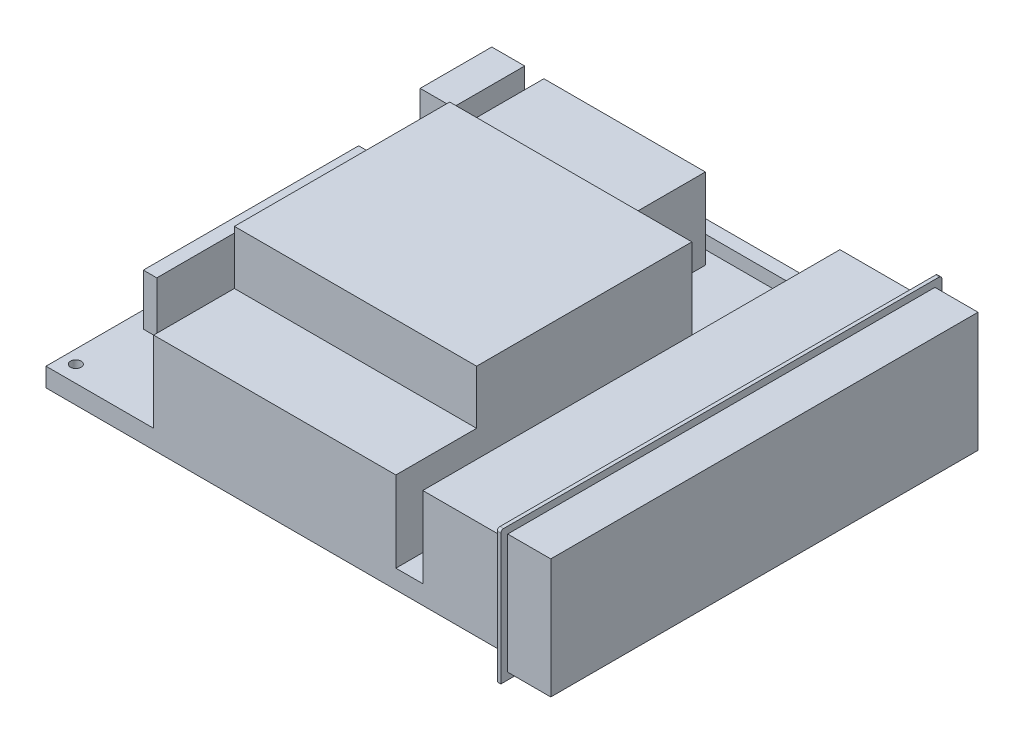
from build123d import *

# Parameters (mm, degrees)
SKETCH1_W                          = 170
SKETCH1_H                          = 170
ALUSPLAAT_DEPTH                    = 2
SKETCH2_W                          = 30
SKETCH2_H                          = 155
PISTIKUD_DEPTH                     = 35
SKETCH3_W                          = 90
SKETCH3_H                          = 110
CPU_M_LUD_DEPTH                    = 55
SKETCH4_W                          = 60
SKETCH4_H                          = 35
SININE_RADIKAS_DEPTH               = 35
SKETCH5_W                          = 90
SKETCH5_H                          = 5
PCIE_PESA_DEPTH                    = 10
SKETCH6_W                          = 12.216790721
SKETCH6_H                          = 26.62710746
RAID_PESAD_DEPTH                   = 30
SKETCH7_W                          = 170
SKETCH7_H                          = 170
LE_LDINE_M_RA_DEPTH                = 5
SKETCH8_W                          = 5
SKETCH8_H                          = 80
PATREI_JA_IGASUGUSED_L_LITID_DEPTH = 19
SKETCH9_OUTSIDE_W                  = 221.416
SKETCH9_OUTSIDE_H                  = 221.416
SKETCH9_OUTSIDE_W_2                = 90
SKETCH9_OUTSIDE_H_2                = 80
M_LUD_DEPTH                        = 20
CUT_EXTRUDE2_REACH                 = 132.192
SKETCH10_R                         = 1.98
BOSS_EXTRUDE1_DEPTH                = 1.32
SKETCH12_W                         = 158.75
SKETCH12_H                         = 44.45
BOSS_EXTRUDE2_DEPTH                = 16


with BuildPart() as part:
    # Sketch1 → alusplaat (new body)
    with BuildSketch(Plane(origin=(0, 0, 0), x_dir=(1, 0, 0), z_dir=(0, 1, 0))):
        Rectangle(SKETCH1_W, SKETCH1_H)
    extrude(amount=ALUSPLAAT_DEPTH)

    # Sketch2 → pistikud (add)
    with BuildSketch(Plane(origin=(0, 2, 0), x_dir=(-1, 0, 0), z_dir=(0, 1, 0))):
        with Locations((-70, 7.5)):
            Rectangle(SKETCH2_W, SKETCH2_H)
    extrude(amount=PISTIKUD_DEPTH)

    # Sketch3 → cpu+mälud (add)
    with BuildSketch(Plane(origin=(0, 2, 0), x_dir=(1, 0, 0), z_dir=(0, 1, 0))):
        with Locations((0, -30)):
            Rectangle(SKETCH3_W, SKETCH3_H)
    extrude(amount=CPU_M_LUD_DEPTH)

    # Sketch4 → sinine radikas (add)
    with BuildSketch(Plane(origin=(0, 2, 0), x_dir=(1, 0, 0), z_dir=(0, 1, 0))):
        with Locations((-25, 52.5)):
            Rectangle(SKETCH4_W, SKETCH4_H)
    extrude(amount=SININE_RADIKAS_DEPTH)

    # Sketch5 → pcie pesa (add)
    with BuildSketch(Plane(origin=(0, 2, 0), x_dir=(-1, 0, 0), z_dir=(0, 1, 0))):
        with Locations((0, -77.5)):
            Rectangle(SKETCH5_W, SKETCH5_H)
    extrude(amount=PCIE_PESA_DEPTH)

    # Sketch6 → raid pesad (add)
    with BuildSketch(Plane(origin=(0, 2, 0), x_dir=(-1, 0, 0), z_dir=(0, 1, 0))):
        with Locations((73.780405742, -62.225935716)):
            Rectangle(SKETCH6_W, SKETCH6_H)
    extrude(amount=RAID_PESAD_DEPTH)

    # Sketch7 → üleüldine müra (add)
    with BuildSketch(Plane(origin=(0, 2, 0), x_dir=(-1, 0, 0), z_dir=(0, 1, 0))):
        Rectangle(SKETCH7_W, SKETCH7_H)
    extrude(amount=LE_LDINE_M_RA_DEPTH)

    # Sketch8 → patrei ja igasugused lülitid (add)
    with BuildSketch(Plane(origin=(0, 7, 0), x_dir=(-1, 0, 0), z_dir=(0, 1, 0))):
        with Locations((76.340130234, 15)):
            Rectangle(SKETCH8_W, SKETCH8_H)
    extrude(amount=PATREI_JA_IGASUGUSED_L_LITID_DEPTH)

    # Sketch9 outside → mälud (cut)
    with BuildSketch(Plane(origin=(0, 57, 0), x_dir=(-1, 0, 0), z_dir=(0, 1, 0))):
        Rectangle(SKETCH9_OUTSIDE_W, SKETCH9_OUTSIDE_H)
        with Locations((0, 15)):
            Rectangle(SKETCH9_OUTSIDE_W_2, SKETCH9_OUTSIDE_H_2, mode=Mode.SUBTRACT)
    extrude(amount=-M_LUD_DEPTH, mode=Mode.SUBTRACT)

    # Sketch10 → Cut-Extrude2 (cut, up to next)
    with BuildSketch(Plane(origin=(0, 7, 0), x_dir=(1, 0, 0), z_dir=(0, 1, 0)), mode=Mode.PRIVATE) as cut_extrude2_sk1:
        with Locations((74.84, 78.65)):
            Circle(SKETCH10_R)
    cut_extrude2_tool1 = extrude(cut_extrude2_sk1.sketch, amount=-CUT_EXTRUDE2_REACH, mode=Mode.PRIVATE) & part.part
    # Sketch10 → Cut-Extrude2 (cut, up to next)
    with BuildSketch(Plane(origin=(0, 7, 0), x_dir=(1, 0, 0), z_dir=(0, 1, 0)), mode=Mode.PRIVATE) as cut_extrude2_sk2:
        with Locations((-80.1, 78.65)):
            Circle(SKETCH10_R)
    cut_extrude2_tool2 = extrude(cut_extrude2_sk2.sketch, amount=-CUT_EXTRUDE2_REACH, mode=Mode.PRIVATE) & part.part
    # Sketch10 → Cut-Extrude2 (cut, up to next)
    with BuildSketch(Plane(origin=(0, 7, 0), x_dir=(1, 0, 0), z_dir=(0, 1, 0)), mode=Mode.PRIVATE) as cut_extrude2_sk3:
        with Locations((-80.1, -78.83)):
            Circle(SKETCH10_R)
    cut_extrude2_tool3 = extrude(cut_extrude2_sk3.sketch, amount=-CUT_EXTRUDE2_REACH, mode=Mode.PRIVATE) & part.part
    # Sketch10 → Cut-Extrude2 (cut, up to next)
    with BuildSketch(Plane(origin=(0, 7, 0), x_dir=(1, 0, 0), z_dir=(0, 1, 0)), mode=Mode.PRIVATE) as cut_extrude2_sk4:
        with Locations((51.98, -78.83)):
            Circle(SKETCH10_R)
    cut_extrude2_tool4 = extrude(cut_extrude2_sk4.sketch, amount=-CUT_EXTRUDE2_REACH, mode=Mode.PRIVATE) & part.part
    add(cut_extrude2_tool1.solids().sort_by_distance((74.84, 7, -78.65))[0], mode=Mode.SUBTRACT)
    add(cut_extrude2_tool2.solids().sort_by_distance((-80.1, 7, -78.65))[0], mode=Mode.SUBTRACT)
    add(cut_extrude2_tool3.solids().sort_by_distance((-80.1, 7, 78.83))[0], mode=Mode.SUBTRACT)
    add(cut_extrude2_tool4.solids().sort_by_distance((51.98, 7, 78.83))[0], mode=Mode.SUBTRACT)


with BuildPart() as body_2:
    # Sketch11 → Boss-Extrude1 (new body)
    with BuildSketch(Plane(origin=(87.11, 0, 0), x_dir=(0, 0, -1), z_dir=(1, 0, 0))):
        with BuildLine():
            Line((-88.415, 43.18), (73.415, 43.18))
            ThreePointArc((73.415, 43.18), (74.122106781, 42.887106781), (74.415, 42.18))
            Line((74.415, 42.18), (74.415, -5.35))
            ThreePointArc((74.415, -5.35), (74.122106781, -6.057106781), (73.415, -6.35))
            Line((73.415, -6.35), (-89.415, -6.35))
            Line((-89.415, -6.35), (-89.415, 42.18))
            ThreePointArc((-89.415, 42.18), (-89.122106781, 42.887106781), (-88.415, 43.18))
        make_face()
    extrude(amount=BOSS_EXTRUDE1_DEPTH)


with BuildPart() as body_3:
    # Sketch12 → Boss-Extrude2 (new body)
    with BuildSketch(Plane(origin=(88.43, 0, 0), x_dir=(0, 0, -1), z_dir=(1, 0, 0))):
        with Locations((-7.5, 18.415)):
            Rectangle(SKETCH12_W, SKETCH12_H)
    extrude(amount=BOSS_EXTRUDE2_DEPTH)


solid = Compound([part.part, body_2.part, body_3.part])
